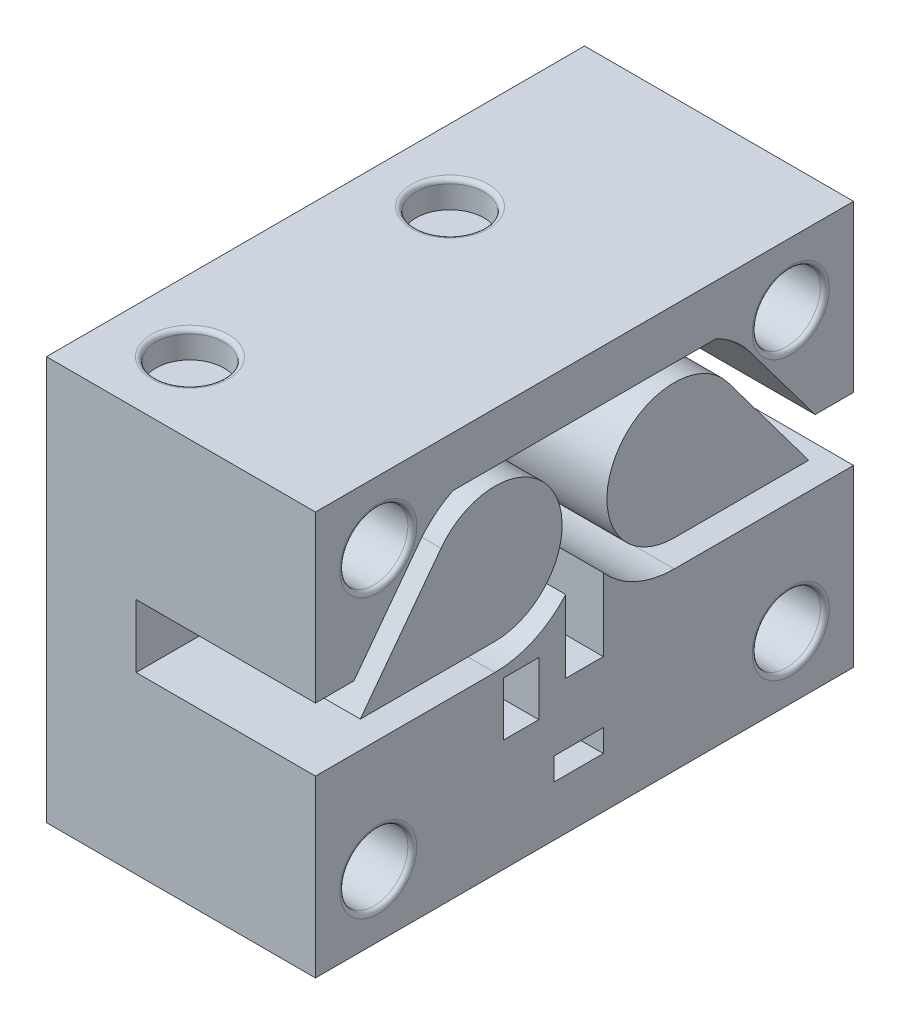
from build123d import *

# Parameters (mm, degrees)
BOSS_EXTRUDE1_OUTLINE_W   = 3.954765607
BOSS_EXTRUDE1_OUTLINE_H   = 6
BOSS_EXTRUDE1_DEPTH       = 10
BOSS_EXTRUDE2_OUTLINE_W   = 5.5
BOSS_EXTRUDE2_OUTLINE_H   = 2.514395902
BOSS_EXTRUDE2_OUTLINE_W_2 = 3.954765607
BOSS_EXTRUDE2_OUTLINE_H_2 = 6
BOSS_EXTRUDE2_DEPTH       = 30
SKETCH2_R                 = 3.8
CUT_EXTRUDE1_DEPTH        = 3
SKETCH3_R                 = 3.8
CUT_EXTRUDE2_DEPTH        = 49.023431781
FILLET1_R                 = 0.5
FILLET2_R                 = 0.5
FILLET3_R                 = 0.5
SKETCH4_R                 = 3.925
CUT_EXTRUDE3_DEPTH        = 3
FILLET4_R                 = 0.5


# Read off the part's stored shape, not the designer's step: Boss-Extrude1, Boss-Extrude2
with BuildPart() as part:
    # Boss-Extrude1 outline → Boss-Extrude1 (new body)
    # profile 1 of 3: a face of its own
    with BuildSketch(Plane(origin=(0, 0, 0), x_dir=(0, 0, -1), z_dir=(1, 0, 0))):
        with BuildLine():
            Line((25.714279333, 4.047627556), (18.4, 13.8))
            ThreePointArc((18.4, 13.8), (16.720396487, 15.567606278), (14.678379216, 16.900147228))
            Line((14.678379216, 16.900147228), (-14.678379216, 16.900147228))
            ThreePointArc((-14.678379216, 16.900147228), (-16.720396487, 15.567606278), (-18.4, 13.8))
            Line((-18.4, 13.8), (-25.714279333, 4.047627556))
            Line((-25.714279333, 4.047627556), (-30, 4.047627556))
            Line((-30, 4.047627556), (-30, -3))
            Line((-30, -3), (-10, -3))
            ThreePointArc((-10, -3), (-5.663072607, -2.062481937), (-2.100611456, 0.582655088))
            Line((-2.100611456, 0.582655088), (-2.100611456, -7.512763106))
            Line((-2.100611456, -7.512763106), (2.100327913, -7.512763106))
            Line((2.100327913, -7.512763106), (2.100611456, 0.582655088))
            ThreePointArc((2.100611456, 0.582655088), (5.663072607, -2.062481937), (10, -3))
            Line((10, -3), (30, -3))
            Line((30, -3), (30, 4.047627556))
            Line((30, 4.047627556), (25.714279333, 4.047627556))
        make_face()
        with BuildLine():
            Line((-25, 0), (-16, 12))
            ThreePointArc((-16, 12), (-3.291796068, 10.854101966), (-10, 0))
            Line((-10, 0), (-25, 0))
        make_face(mode=Mode.SUBTRACT)
        with BuildLine():
            Line((16, 12), (25, 0))
            Line((25, 0), (10, 0))
            ThreePointArc((10, 0), (3.291796068, 10.854101966), (16, 12))
        make_face(mode=Mode.SUBTRACT)
    # profile 2 of 3: a face of its own
    with BuildSketch(Plane(origin=(0, 0, 0), x_dir=(0, 0, -1), z_dir=(1, 0, 0))):
        Polygon((2.100088067, -14.360604098), (-3.399911933, -14.360604098), (-3.399911933, -16.875), (2.1, -16.875), align=None)
    # profile 3 of 3: a face of its own
    with BuildSketch(Plane(origin=(0, 0, 0), x_dir=(0, 0, -1), z_dir=(1, 0, 0))):
        with Locations((-7.07799426, -7.005350079)):
            Rectangle(BOSS_EXTRUDE1_OUTLINE_W, BOSS_EXTRUDE1_OUTLINE_H)
    extrude(amount=BOSS_EXTRUDE1_DEPTH)

    # Boss-Extrude2 outline → Boss-Extrude2 (add)
    # profile 1 of 4: a face of its own
    with BuildSketch(Plane(origin=(0, 0, 0), x_dir=(0, 0, -1), z_dir=(1, 0, 0))):
        with BuildLine():
            Line((30, 22.5), (-30, 22.5))
            Line((-30, 22.5), (-30, 4.047627556))
            Line((-30, 4.047627556), (-25.714279333, 4.047627556))
            Line((-25.714279333, 4.047627556), (-18.4, 13.8))
            ThreePointArc((-18.4, 13.8), (-16.720396487, 15.567606278), (-14.678379216, 16.900147228))
            Line((-14.678379216, 16.900147228), (14.678379216, 16.900147228))
            ThreePointArc((14.678379216, 16.900147228), (16.720396487, 15.567606278), (18.4, 13.8))
            Line((18.4, 13.8), (25.714279333, 4.047627556))
            Line((25.714279333, 4.047627556), (30, 4.047627556))
            Line((30, 4.047627556), (30, 22.5))
        make_face()
    # profile 2 of 4: a face of its own
    with BuildSketch(Plane(origin=(0, 0, 0), x_dir=(0, 0, -1), z_dir=(1, 0, 0))):
        with BuildLine():
            Line((-10, -3), (-30, -3))
            Line((-30, -3), (-30, -22.5))
            Line((-30, -22.5), (30, -22.5))
            Line((30, -22.5), (30, -3))
            Line((30, -3), (10, -3))
            ThreePointArc((10, -3), (5.663072607, -2.062481937), (2.100611456, 0.582655088))
            Line((2.100611456, 0.582655088), (2.100327913, -7.512763106))
            Line((2.100327913, -7.512763106), (-2.100611456, -7.512763106))
            Line((-2.100611456, -7.512763106), (-2.100611456, 0.582655088))
            ThreePointArc((-2.100611456, 0.582655088), (-5.663072607, -2.062481937), (-10, -3))
        make_face()
        with Locations((-0.649911933, -15.617802049)):
            Rectangle(BOSS_EXTRUDE2_OUTLINE_W, BOSS_EXTRUDE2_OUTLINE_H, mode=Mode.SUBTRACT)
        with Locations((-7.07799426, -7.005350079)):
            Rectangle(BOSS_EXTRUDE2_OUTLINE_W_2, BOSS_EXTRUDE2_OUTLINE_H_2, mode=Mode.SUBTRACT)
    # profile 3 of 4: a face of its own
    with BuildSketch(Plane(origin=(0, 0, 0), x_dir=(0, 0, -1), z_dir=(1, 0, 0))):
        with BuildLine():
            ThreePointArc((-10, 0), (-3.291796068, 10.854101966), (-16, 12))
            Line((-16, 12), (-25, 0))
            Line((-25, 0), (-10, 0))
        make_face()
    # profile 4 of 4: a face of its own
    with BuildSketch(Plane(origin=(0, 0, 0), x_dir=(0, 0, -1), z_dir=(1, 0, 0))):
        with BuildLine():
            Line((10, 0), (25, 0))
            Line((25, 0), (16, 12))
            ThreePointArc((16, 12), (3.291796068, 10.854101966), (10, 0))
        make_face()
    extrude(amount=BOSS_EXTRUDE2_DEPTH)

    # Sketch2 → Cut-Extrude1 (cut)
    with BuildSketch(Plane(origin=(0, 22.5, 0), x_dir=(1, 0, 0), z_dir=(0, 1, 0))):
        with Locations(Location((8, -22, 0), (0, 0, 270))):
            Circle(SKETCH2_R)
        with Locations(Location((8, 7, 0), (0, 0, 270))):
            Circle(SKETCH2_R)
    extrude(amount=-CUT_EXTRUDE1_DEPTH, mode=Mode.SUBTRACT)

    # Sketch3 → Cut-Extrude2 (cut, through all)
    with BuildSketch(Plane(origin=(30, 0, 0), x_dir=(0, 0, -1), z_dir=(1, 0, 0))):
        with Locations((-23, 15.5)):
            Circle(SKETCH3_R)
        with Locations(Location((23, 15.5, 0), (0, 0, 180))):
            Circle(SKETCH3_R)
        with Locations((23, -15.5)):
            Circle(SKETCH3_R)
        with Locations(Location((-23, -15.5, 0), (0, 0, 180))):
            Circle(SKETCH3_R)
    extrude(amount=-CUT_EXTRUDE2_DEPTH, mode=Mode.SUBTRACT)

    # Fillet1
    fillet1_edges = [part.edges().sort_by_distance(p)[0] for p in [
        (30, -15.5, 19.2),
        (30, -15.5, -19.2),
        (30, 15.5, -26.8),
        (30, 15.5, 26.8),
    ]]
    fillet(fillet1_edges, radius=FILLET1_R)

    # Fillet2
    fillet2_edges = [part.edges().sort_by_distance(p)[0] for p in [
        (0, -15.5, 19.2),
        (0, -15.5, -19.2),
        (0, 15.5, -26.8),
        (0, 15.5, 26.8),
    ]]
    fillet(fillet2_edges, radius=FILLET2_R)

    # Fillet3
    fillet3_edges = [part.edges().sort_by_distance(p)[0] for p in [
        (8, 22.5, 18.2),
        (8, 22.5, -10.8),
    ]]
    fillet(fillet3_edges, radius=FILLET3_R)

    # Sketch4 → Cut-Extrude3 (cut)
    with BuildSketch(Plane.XZ.offset(22.5)):
        with Locations(Location((9, 15, 0), (0, 0, 270))):
            Circle(SKETCH4_R)
        with Locations(Location((9, -15, 0), (0, 0, 90))):
            Circle(SKETCH4_R)
    extrude(amount=-CUT_EXTRUDE3_DEPTH, mode=Mode.SUBTRACT)

    # Fillet4
    fillet4_edges = [part.edges().sort_by_distance(p)[0] for p in [
        (9, -22.5, 18.925),
        (9, -22.5, -18.925),
    ]]
    fillet(fillet4_edges, radius=FILLET4_R)


solid = part.part
